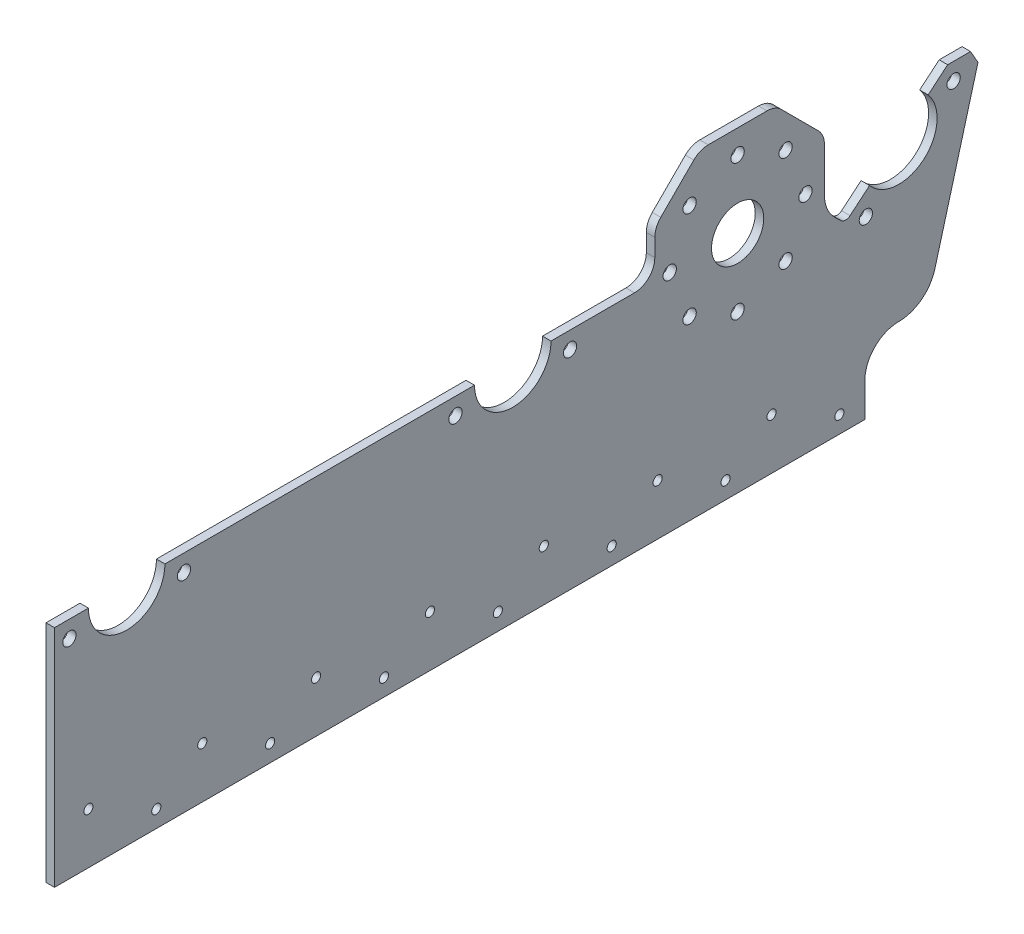
from build123d import *

# Parameters (mm, degrees)
SKETCH1_R                        = 9.779
SKETCH1_R_2                      = 2.413
BOSS_EXTRUDE1_DEPTH              = 3.175
F_10_CLEARANCE_HOLE1_D           = 4.9784
F_10_CLEARANCE_HOLE2_D           = 4.9784
F_10_CLEARANCE_HOLE2_DEPTH       = 3.175
F_10_CLEARANCE_HOLE2_TIP         = 1.495662253
CHAMFER1_SIZE                    = 5.08
CHAMFER1_SIZE2                   = 4.1342197
FILLET1_R                        = 7.62
F_1_8_0_135_DIAMETER_HOLE1_D     = 3.429
F_1_8_0_135_DIAMETER_HOLE1_DEPTH = 16.51
F_1_8_0_135_DIAMETER_HOLE1_TIP   = 1.030175531


with BuildPart() as part:
    # Sketch1 → Boss-Extrude1 (new body)
    with BuildSketch(Plane(origin=(0, 0, 0), x_dir=(0, 0, -1), z_dir=(1, 0, 0))):
        with BuildLine():
            Line((-12.7, -12.7), (-315.9379, -12.7))
            Line((-315.9379, -12.7), (-315.9379, 71.4629))
            Line((-315.9379, 71.4629), (-303.2379, 71.4629))
            ThreePointArc((-303.2379, 71.4629), (-288.925, 57.15), (-274.6121, 71.4629))
            Line((-274.6121, 71.4629), (-158.7754, 71.4629))
            ThreePointArc((-158.7754, 71.4629), (-144.4625, 57.15), (-130.1496, 71.4629))
            Line((-130.1496, 71.4629), (-91.313, 71.4629))
            Line((-91.313, 71.4629), (-91.313, 88.788677931))
            Line((-91.313, 88.788677931), (-74.475777931, 105.6259))
            Line((-74.475777931, 105.6259), (-46.174222069, 105.6259))
            Line((-46.174222069, 105.6259), (-27.855333333, 87.307011265))
            Line((-27.855333333, 87.307011265), (-27.855333333, 67.615437998))
            ThreePointArc((-27.855333333, 67.615437998), (-26.836905275, 62.632379001), (-23.944959008, 58.448514823))
            Line((-23.944959008, 58.448514823), (-21.653228214, 56.251108404))
            ThreePointArc((-21.653228214, 56.251108404), (-19.979435171, 55.545886769), (-18.262622551, 56.138740153))
            Line((-18.262622551, 56.138740153), (-10.96431751, 62.262745221))
            ThreePointArc((-10.96431751, 62.262745221), (9.200154779, 60.49858249), (10.96431751, 80.663054779))
            Line((10.96431751, 80.663054779), (18.262622551, 86.787059847))
            Line((18.262622551, 86.787059847), (30.962622551, 86.787059847))
            Line((30.962622551, 86.787059847), (13.473085073, 22.977185543))
            ThreePointArc((13.473085073, 22.977185543), (8.472670241, 15.562580904), (0, 12.7))
            ThreePointArc((0, 12.7), (-8.980256121, 8.980256121), (-12.7, 0))
            Line((-12.7, 0), (-12.7, -12.7))
        make_face()
        with Locations((-60.325, 71.4629)):
            Circle(SKETCH1_R, mode=Mode.SUBTRACT)
        with Locations((-60.325, 96.8629)):
            Circle(SKETCH1_R_2, mode=Mode.SUBTRACT)
        with Locations((-42.364487758, 89.423412242)):
            Circle(SKETCH1_R_2, mode=Mode.SUBTRACT)
        with Locations((-34.925, 71.4629)):
            Circle(SKETCH1_R_2, mode=Mode.SUBTRACT)
        with Locations((-42.364487758, 53.502387758)):
            Circle(SKETCH1_R_2, mode=Mode.SUBTRACT)
        with Locations((-60.325, 46.0629)):
            Circle(SKETCH1_R_2, mode=Mode.SUBTRACT)
        with Locations((-78.285512242, 53.502387758)):
            Circle(SKETCH1_R_2, mode=Mode.SUBTRACT)
        with Locations((-85.725, 71.4629)):
            Circle(SKETCH1_R_2, mode=Mode.SUBTRACT)
        with Locations((-78.285512242, 89.423412242)):
            Circle(SKETCH1_R_2, mode=Mode.SUBTRACT)
    extrude(amount=BOSS_EXTRUDE1_DEPTH)

    # #10 Clearance Hole1 (through all)
    with Locations(Plane(origin=(3.175, 0, 0), x_dir=(0, 0, -1), z_dir=(1, 0, 0))):
        with Locations((-310.35625, 65.1129), (-267.49375, 65.1129), (-165.89375, 65.1129), (-123.03125, 65.1129), (-12.33558865, 52.822775826), (20.498991293, 80.374259746)):
            Hole(F_10_CLEARANCE_HOLE1_D / 2)

    # #10 Clearance Hole2
    with Locations(Plane(origin=(3.175, 0, 0), x_dir=(0, 0, -1), z_dir=(1, 0, 0))):
        with Locations((-60.325, 96.8629), (-42.364487758, 89.423412242), (-34.925, 71.4629), (-42.364487758, 53.502387758), (-60.325, 46.0629), (-78.285512242, 53.502387758), (-85.725, 71.4629), (-78.285512242, 89.423412242)):
            Hole(F_10_CLEARANCE_HOLE2_D / 2, depth=F_10_CLEARANCE_HOLE2_DEPTH)
            with Locations((0, 0, -(F_10_CLEARANCE_HOLE2_DEPTH + F_10_CLEARANCE_HOLE2_TIP / 2))):  # 118° drill point
                Cone(0, F_10_CLEARANCE_HOLE2_D / 2, F_10_CLEARANCE_HOLE2_TIP, mode=Mode.SUBTRACT)

    # Chamfer1
    chamfer1_edges = [part.edges().sort_by_distance(p)[0] for p in [
        (1.5875, 86.787059847, -30.962622551),
    ]]
    chamfer1_side = [part.faces().sort_by_distance(p)[0] for p in [
        (1.5875, 54.882122695, -22.217853812),
    ]]
    chamfer(chamfer1_edges, length=CHAMFER1_SIZE, length2=CHAMFER1_SIZE2, reference=chamfer1_side[0])

    # Fillet1
    fillet1_edges = [part.edges().sort_by_distance(p)[0] for p in [
        (1.5875, 87.307011265, 27.855333333),
        (1.5875, 105.6259, 46.174222069),
        (1.5875, 105.6259, 74.475777931),
        (1.5875, 88.788677931, 91.313),
        (1.5875, 71.4629, 91.313),
    ]]
    fillet(fillet1_edges, radius=FILLET1_R)

    # 1/8 (0.135) Diameter Hole1
    with Locations(Plane.ZY):
        with Locations((22.2504, -6.35), (47.6504, 6.35), (64.848316667, -6.35), (90.248316667, 6.35), (107.446233333, -6.35), (132.846233333, 6.35), (150.04415, -6.35), (175.44415, 6.35), (192.642066667, -6.35), (218.042066667, 6.35), (235.239983333, -6.35), (260.639983333, 6.35), (277.8379, -6.35), (303.2379, 6.35)):
            Hole(F_1_8_0_135_DIAMETER_HOLE1_D / 2, depth=F_1_8_0_135_DIAMETER_HOLE1_DEPTH)
            with Locations((0, 0, -(F_1_8_0_135_DIAMETER_HOLE1_DEPTH + F_1_8_0_135_DIAMETER_HOLE1_TIP / 2))):  # 118° drill point
                Cone(0, F_1_8_0_135_DIAMETER_HOLE1_D / 2, F_1_8_0_135_DIAMETER_HOLE1_TIP, mode=Mode.SUBTRACT)


solid = part.part
